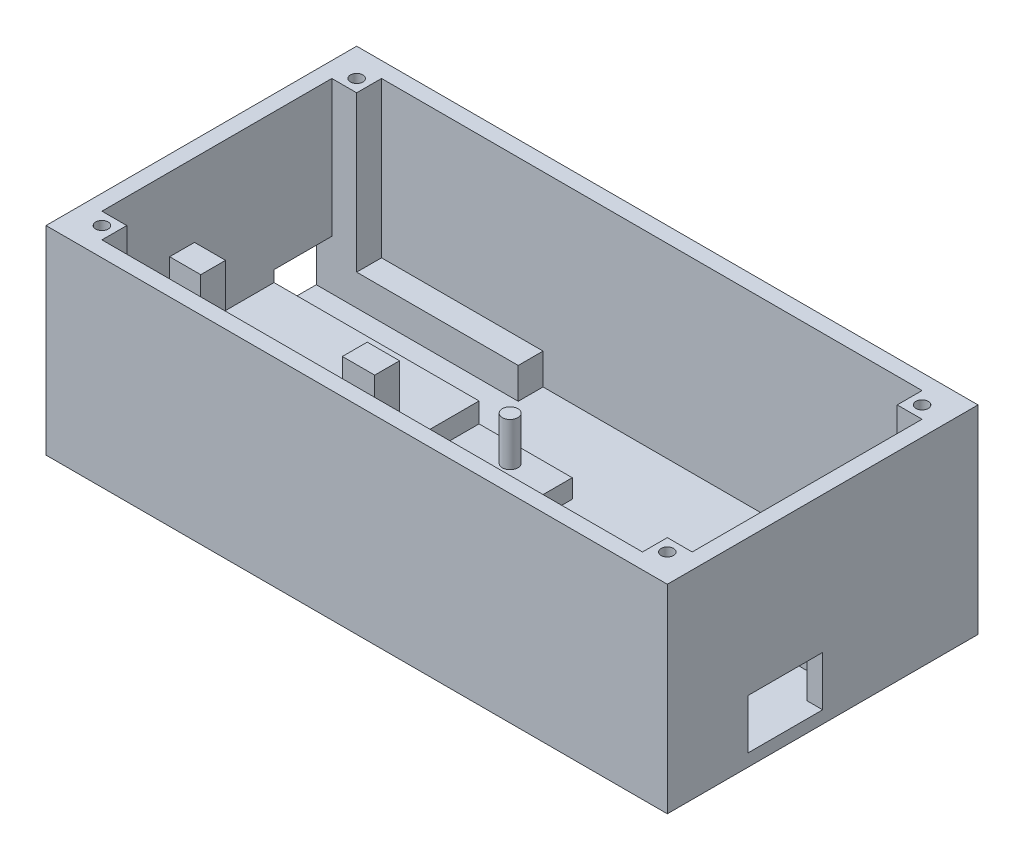
from build123d import *

# Parameters (mm, degrees)
SKETCH1_W           = 100
SKETCH1_H           = 50
BOSS_EXTRUDE1_DEPTH = 2
SKETCH3_W           = 100
SKETCH3_H           = 50
SKETCH3_R           = 1
BOSS_EXTRUDE2_DEPTH = 30
BOSS_EXTRUDE3_DEPTH = 6.2
SKETCH6_W           = 5
SKETCH6_H           = 4
SKETCH6_W_2         = 5.2
BOSS_EXTRUDE4_DEPTH = 12
SKETCH7_W           = 9.3
SKETCH7_H           = 8
CUT_EXTRUDE1_DEPTH  = 15
SKETCH9_W           = 30
SKETCH9_H           = 4
SKETCH9_W_2         = 15
BOSS_EXTRUDE5_DEPTH = 5
SKETCH12_R          = 1.25
BOSS_EXTRUDE6_DEPTH = 10
SKETCH8_W           = 12
SKETCH8_H           = 8
CUT_EXTRUDE2_DEPTH  = 10
SKETCH13_W          = 20
SKETCH13_H          = 5
SKETCH13_W_2        = 15
BOSS_EXTRUDE7_DEPTH = 3


with BuildPart() as part:
    # Sketch1 → Boss-Extrude1 (new body)
    with BuildSketch(Plane(origin=(0, 0, 0), x_dir=(1, 0, 0), z_dir=(0, 1, 0))):
        with Locations((50, 25)):
            Rectangle(SKETCH1_W, SKETCH1_H)
    extrude(amount=BOSS_EXTRUDE1_DEPTH)

    # Sketch3 → Boss-Extrude2 (add)
    with BuildSketch(Plane(origin=(0, 2, 0), x_dir=(1, 0, 0), z_dir=(0, 1, 0))):
        with Locations((50, 25)):
            Rectangle(SKETCH3_W, SKETCH3_H)
        with Locations((4.5, 45.5)):
            Circle(SKETCH3_R, mode=Mode.SUBTRACT)
        with Locations((95.5, 45.5)):
            Circle(SKETCH3_R, mode=Mode.SUBTRACT)
        with Locations((95.5, 4.5)):
            Circle(SKETCH3_R, mode=Mode.SUBTRACT)
        with Locations((4.5, 4.5)):
            Circle(SKETCH3_R, mode=Mode.SUBTRACT)
        Polygon((6.5, 47.5), (93.5, 47.5), (93.5, 43.5), (97.5, 43.5), (97.5, 6.5), (93.5, 6.5), (93.5, 2.5), (6.5, 2.5), (6.5, 6.5), (2.5, 6.5), (2.5, 43.5), (6.5, 43.5), align=None, mode=Mode.SUBTRACT)
    extrude(amount=BOSS_EXTRUDE2_DEPTH)

    # Sketch4 → Boss-Extrude3 (add)
    with BuildSketch(Plane(origin=(0, 2, 0), x_dir=(1, 0, 0), z_dir=(0, 1, 0))):
        Polygon((2.5, 34.2), (35.5, 34.2), (35.5, 2.5), (6.5, 2.5), (6.5, 6.5), (2.5, 6.5), align=None)
    extrude(amount=BOSS_EXTRUDE3_DEPTH)

    # Sketch6 → Boss-Extrude4 (add)
    with BuildSketch(Plane(origin=(0, 8.2, 0), x_dir=(1, 0, 0), z_dir=(0, 1, 0))):
        with Locations((5, 19.4)):
            Rectangle(SKETCH6_W, SKETCH6_H)
        with Locations((32.9, 19.4)):
            Rectangle(SKETCH6_W_2, SKETCH6_H)
    extrude(amount=BOSS_EXTRUDE4_DEPTH)

    # Sketch7 → Cut-Extrude1 (cut)
    with BuildSketch(Plane(origin=(2.5, 0, 0), x_dir=(0, 0, -1), z_dir=(1, 0, 0))):
        with Locations((38.85, 6)):
            Rectangle(SKETCH7_W, SKETCH7_H)
    extrude(amount=-CUT_EXTRUDE1_DEPTH, mode=Mode.SUBTRACT)

    # Sketch9 → Boss-Extrude5 (add)
    with BuildSketch(Plane(origin=(0, 2, 0), x_dir=(1, 0, 0), z_dir=(0, 1, 0))):
        with Locations((17.5, 45.5)):
            Rectangle(SKETCH9_W, SKETCH9_H)
        with Locations((86, 45.5)):
            Rectangle(SKETCH9_W_2, SKETCH9_H)
    extrude(amount=BOSS_EXTRUDE5_DEPTH)

    # Sketch12 → Boss-Extrude6 (add)
    with BuildSketch(Plane(origin=(0, 2, 0), x_dir=(1, 0, 0), z_dir=(0, 1, 0))):
        with Locations((90, 7.7)):
            Circle(SKETCH12_R)
        with Locations((43.5, 7.7)):
            Circle(SKETCH12_R)
        with Locations((43.5, 31.2)):
            Circle(SKETCH12_R)
        with Locations((90, 31.2)):
            Circle(SKETCH12_R)
    extrude(amount=BOSS_EXTRUDE6_DEPTH)

    # Sketch8 → Cut-Extrude2 (cut)
    with BuildSketch(Plane.ZY.offset(-97.5)):
        with Locations((-19, 6)):
            Rectangle(SKETCH8_W, SKETCH8_H)
    extrude(amount=-CUT_EXTRUDE2_DEPTH, mode=Mode.SUBTRACT)

    # Sketch13 → Boss-Extrude7 (add)
    with BuildSketch(Plane(origin=(0, 2, 0), x_dir=(1, 0, 0), z_dir=(0, 1, 0))):
        with Locations((87.5, 31.7)):
            Rectangle(SKETCH13_W, SKETCH13_H)
        with Locations((43, 31.7)):
            Rectangle(SKETCH13_W_2, SKETCH13_H)
    extrude(amount=BOSS_EXTRUDE7_DEPTH)


solid = part.part
